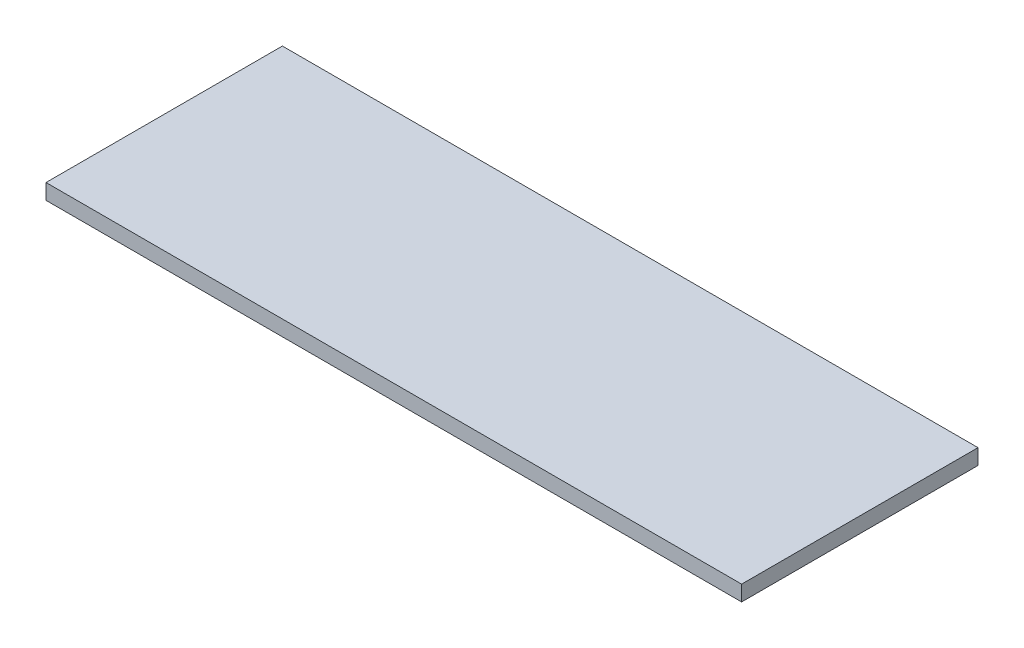
from build123d import *

# Parameters (mm, degrees)
SKETCH1_W           = 54
SKETCH1_H           = 18.35
BOSS_EXTRUDE1_DEPTH = 1.2


with BuildPart() as part:
    # Sketch1 → Boss-Extrude1 (new body)
    with BuildSketch(Plane(origin=(0, 0, 0), x_dir=(1, 0, 0), z_dir=(0, 1, 0))):
        with Locations((27, 9.175)):
            Rectangle(SKETCH1_W, SKETCH1_H)
    extrude(amount=BOSS_EXTRUDE1_DEPTH)


solid = part.part
